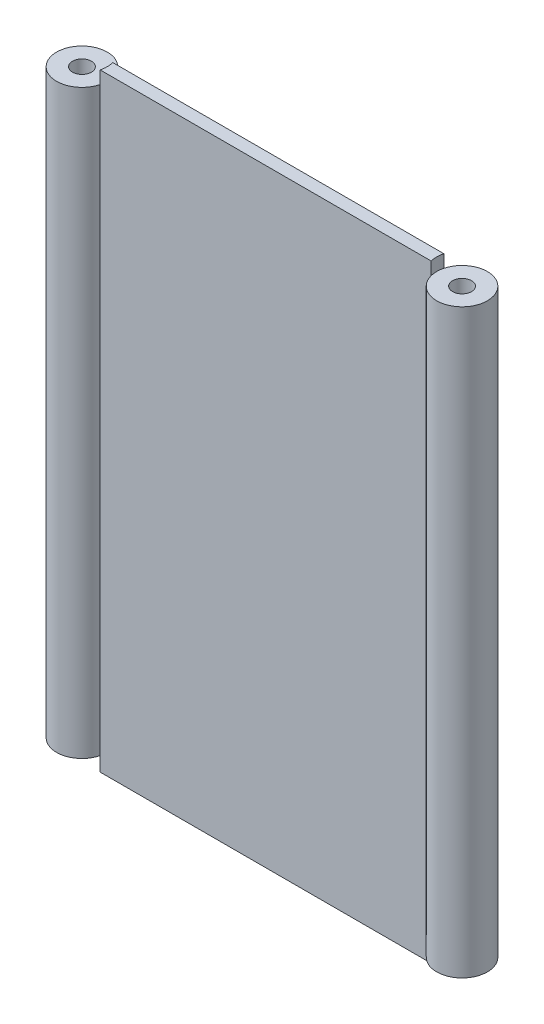
from build123d import *

# Parameters (mm, degrees)
SKETCH1_R           = 2.38125
BOSS_EXTRUDE1_DEPTH = 152.4
SKETCH2_R           = 6.35
CUT_EXTRUDE1_DEPTH  = 3.571875
CUT_EXTRUDE3_START  = -3.175
SKETCH3_R           = 6.35
CUT_EXTRUDE3_DEPTH  = 3.175


with BuildPart() as part:
    # Sketch1 → Boss-Extrude1 (new body)
    with BuildSketch(Plane(origin=(0, 0, 0), x_dir=(1, 0, 0), z_dir=(0, 1, 0))):
        with BuildLine():
            Line((-41.476638938, 3.175), (0, 3.175))
            Line((0, 3.175), (0, 0))
            Line((0, 0), (-41.476638938, 0))
            ThreePointArc((-41.476638938, 0), (-53.975, 1.5875), (-41.476638938, 3.175))
        make_face()
        with Locations((-47.625, 1.5875)):
            Circle(SKETCH1_R, mode=Mode.SUBTRACT)
    boss_extrude1 = extrude(amount=BOSS_EXTRUDE1_DEPTH)

    # Sketch2 → Cut-Extrude1 (cut)
    with BuildSketch(Plane.XZ):
        with Locations((-47.625, -1.5875)):
            Circle(SKETCH2_R)
    cut_extrude1 = extrude(amount=-CUT_EXTRUDE1_DEPTH, mode=Mode.SUBTRACT)

    # Sketch3 → Cut-Extrude3 (cut)
    with BuildSketch(Plane(origin=(0, 152.4, 0), x_dir=(1, 0, 0), z_dir=(0, 1, 0)).offset(CUT_EXTRUDE3_START)):
        with Locations((-47.625, 1.5875)):
            Circle(SKETCH3_R)
    cut_extrude3 = extrude(amount=CUT_EXTRUDE3_DEPTH, mode=Mode.SUBTRACT)

    # Mirror2: Boss-Extrude1, Cut-Extrude1, Cut-Extrude3 across plane
    add(boss_extrude1.mirror(Plane(origin=(0, 152.4, -3.175), x_dir=(0, 0, 1), z_dir=(1, 0, 0))))
    add(cut_extrude1.mirror(Plane(origin=(0, 152.4, -3.175), x_dir=(0, 0, 1), z_dir=(1, 0, 0))), mode=Mode.SUBTRACT)
    add(cut_extrude3.mirror(Plane(origin=(0, 152.4, -3.175), x_dir=(0, 0, 1), z_dir=(1, 0, 0))), mode=Mode.SUBTRACT)


solid = part.part
